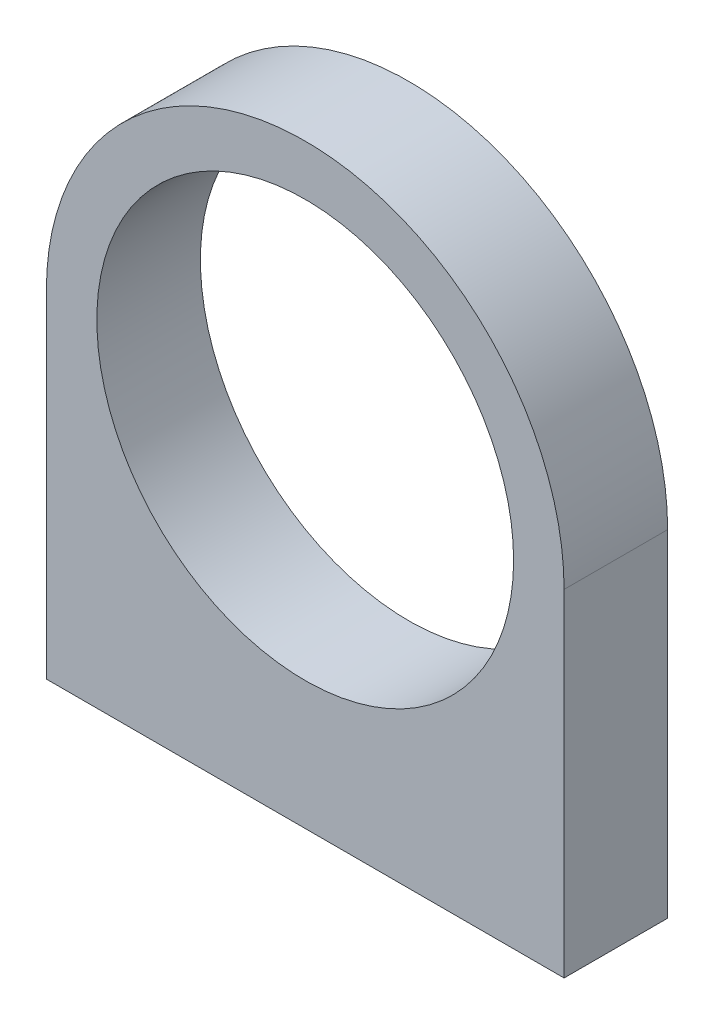
from build123d import *

# Parameters (mm, degrees)
ESQUISSE1_R             = 16.1
BOSS_EXTRU_1_DEPTH      = 8
ESQUISSE2_R             = 1.5
ENL_V_MAT_EXTRU_1_DEPTH = 15


with BuildPart() as part:
    # Esquisse1 → Boss.-Extru.1 (new body)
    with BuildSketch(Plane.XY):
        with BuildLine():
            Line((-20, 0), (-20, -26))
            Line((-20, -26), (20, -26))
            Line((20, -26), (20, 0))
            ThreePointArc((20, 0), (0, 20), (-20, 0))
        make_face()
        Circle(ESQUISSE1_R, mode=Mode.SUBTRACT)
    extrude(amount=BOSS_EXTRU_1_DEPTH)

    # Esquisse2 → Enlèv. mat.-Extru.1 (cut)
    with BuildSketch(Plane.XZ.offset(26)):
        with Locations((-16, 4)):
            Circle(ESQUISSE2_R)
        with Locations((16, 4)):
            Circle(ESQUISSE2_R)
    extrude(amount=-ENL_V_MAT_EXTRU_1_DEPTH, mode=Mode.SUBTRACT)


solid = part.part
